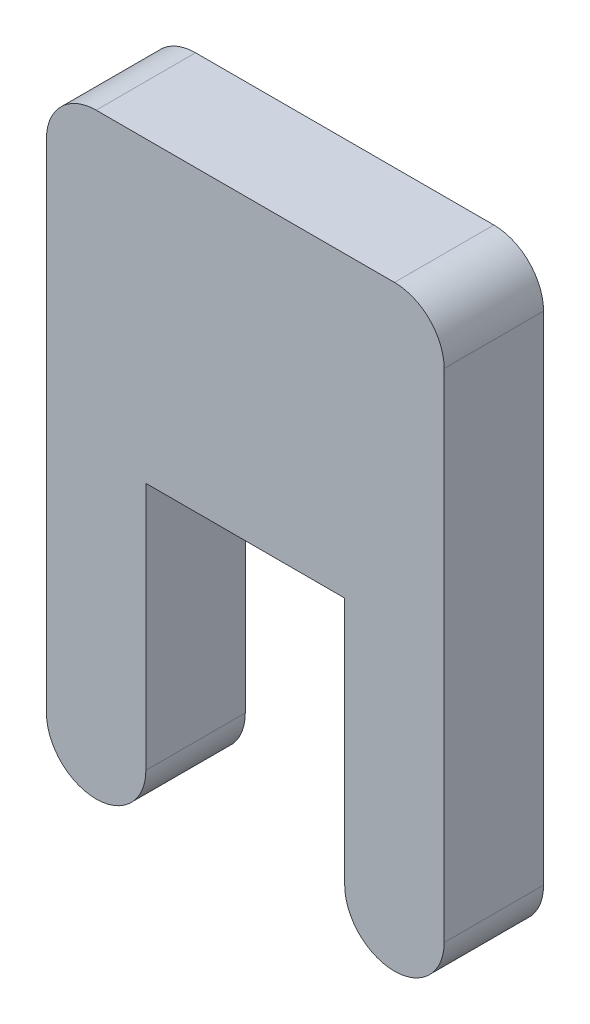
from build123d import *

# Parameters (mm, degrees)
BOSS_EXTRUDE1_DEPTH = 1.25
FILLET1_R           = 1.25


with BuildPart() as part:
    # Sketch1 → Boss-Extrude1 (new, symmetric)
    with BuildSketch(Plane.XY):
        Polygon((-5, 7.5), (-5, -7.5), (-2.5, -7.5), (-2.5, 0), (2.5, 0), (2.5, -7.5), (5, -7.5), (5, 7.5), align=None)
    extrude(amount=BOSS_EXTRUDE1_DEPTH, both=True)

    # Fillet1
    fillet1_edges = [part.edges().sort_by_distance(p)[0] for p in [
        (-2.5, -7.5, 0),
        (-5, -7.5, 0),
        (-5, 7.5, 0),
        (5, 7.5, 0),
        (2.5, -7.5, 0),
        (5, -7.5, 0),
    ]]
    fillet(fillet1_edges, radius=FILLET1_R - 0.0001)  # a hair under: the kernel refuses the full size


solid = part.part
